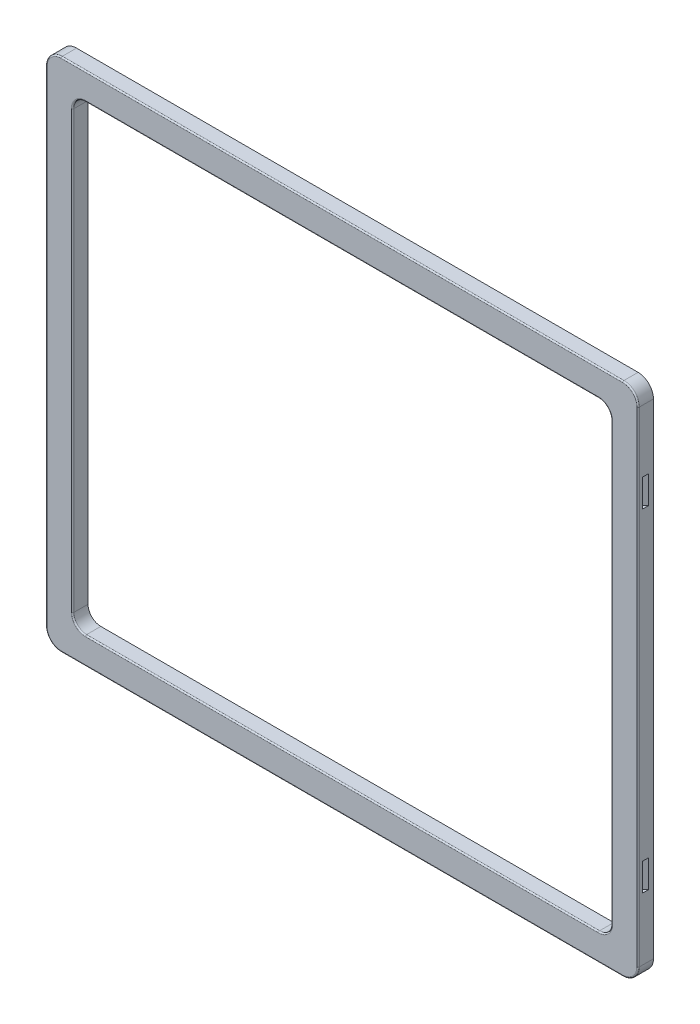
from build123d import *

# Parameters (mm, degrees)
SKETCH1_W                                = 231.5
SKETCH1_H                                = 201.5
SKETCH1_W_2                              = 210.5
SKETCH1_H_2                              = 180.5
MAIN_BODY_DEPTH                          = 6
FILLET1_R                                = 5
FILLET2_R                                = 6
SKETCH3_W                                = 227.5
SKETCH3_H                                = 197.5
SKETCH3_W_2                              = 214
SKETCH3_H_2                              = 184
MAIN_CAVITY_DEPTH                        = 5
FILLET6_R                                = 6
FILLET4_R                                = 5
CAVITY1_START                            = 83.43860018
CAVITY1_OUTLINE_W                        = 1.804040507
CAVITY1_OUTLINE_H                        = 10
CAVITY1_DEPTH                            = 1.060660172
CAVITY1_START_2                          = -80.256619665
CAVITY1_2_OUTLINE_W                      = 1.56139982
CAVITY1_2_OUTLINE_H                      = 10
CAVITY1_2_DEPTH                          = 1.060660172
SNAP_START                               = -0.4
SNAP_FIT_DEPTH                           = 10.8
MIRROR1_START                            = -0.4
MIRROR1_AT_THE_SECOND_PLANE_COPY_1_DEPTH = 10.8
FILLET7_R                                = 0.5


# Read off the part's stored shape, not the designer's step: Cavity1
with BuildPart() as part:
    # Sketch1 → Main Body (new body)
    with BuildSketch(Plane.XY):
        Rectangle(SKETCH1_W, SKETCH1_H)
        Rectangle(SKETCH1_W_2, SKETCH1_H_2, mode=Mode.SUBTRACT)
    extrude(amount=MAIN_BODY_DEPTH)

    # Fillet1
    fillet1_edges = [part.edges().sort_by_distance(p)[0] for p in [
        (105.25, -90.25, 3),
        (105.25, 90.25, 3),
        (-105.25, 90.25, 3),
        (-105.25, -90.25, 3),
    ]]
    fillet(fillet1_edges, radius=FILLET1_R)

    # Fillet2
    fillet2_edges = [part.edges().sort_by_distance(p)[0] for p in [
        (115.75, -100.75, 3),
        (-115.75, -100.75, 3),
        (-115.75, 100.75, 3),
        (115.75, 100.75, 3),
    ]]
    fillet(fillet2_edges, radius=FILLET2_R)

    # Sketch3 → Main Cavity (cut)
    with BuildSketch(Plane(origin=(0, 0, 0), x_dir=(-1, 0, 0), z_dir=(0, 0, -1))):
        Rectangle(SKETCH3_W, SKETCH3_H)
        Rectangle(SKETCH3_W_2, SKETCH3_H_2, mode=Mode.SUBTRACT)
    extrude(amount=-MAIN_CAVITY_DEPTH, mode=Mode.SUBTRACT)

    # Fillet6
    fillet6_edges = [part.edges().sort_by_distance(p)[0] for p in [
        (-113.75, 98.75, 2.5),
        (-113.75, -98.75, 2.5),
        (113.75, -98.75, 2.5),
        (113.75, 98.75, 2.5),
    ]]
    fillet(fillet6_edges, radius=FILLET6_R)

    # Fillet4
    fillet4_edges = [part.edges().sort_by_distance(p)[0] for p in [
        (-107, -92, 2.5),
        (107, -92, 2.5),
        (107, 92, 2.5),
        (-107, 92, 2.5),
    ]]
    fillet(fillet4_edges, radius=FILLET4_R)

    # Cavity1 outline → Cavity1 (cut)
    with BuildSketch(Plane(origin=(0, 0, 0), x_dir=(0.7071067811865474, 0, -0.7071067811865477), z_dir=(0.7071067811865476, 0, 0.7071067811865476)).offset(CAVITY1_START)):
        with Locations((80.097979747, 65)):
            Rectangle(CAVITY1_OUTLINE_W, CAVITY1_OUTLINE_H)
        with Locations((80.097979747, -65)):
            Rectangle(CAVITY1_OUTLINE_W, CAVITY1_OUTLINE_H)
    extrude(amount=CAVITY1_DEPTH, mode=Mode.SUBTRACT)

    # Cavity1 2 outline → Cavity1 2 (cut)
    with BuildSketch(Plane(origin=(0, 0, 0), x_dir=(0.7071067811865474, 0, -0.7071067811865477), z_dir=(0.7071067811865476, 0, 0.7071067811865476)).offset(CAVITY1_START_2)):
        with Locations((-84.21930009, 65)):
            Rectangle(CAVITY1_2_OUTLINE_W, CAVITY1_2_OUTLINE_H)
        with Locations((-84.21930009, -65)):
            Rectangle(CAVITY1_2_OUTLINE_W, CAVITY1_2_OUTLINE_H)
    extrude(amount=CAVITY1_2_DEPTH, mode=Mode.SUBTRACT)

    # Sketch4 → Snap Fit (cut)
    with BuildSketch(Plane.XZ.offset(-70).offset(SNAP_START)):
        Polygon((-115.75, 4.315685425), (-114.575735931, 3.141421356), (-115.75, 1.967157288), align=None)
    snap_fit = extrude(amount=SNAP_FIT_DEPTH, mode=Mode.SUBTRACT)

    # Mirror1: Snap Fit across plane
    add(snap_fit.mirror(Plane.ZX), mode=Mode.SUBTRACT)

    # Mirror1 at the second plane: Snap Fit across plane
    add(snap_fit.mirror(Plane(origin=(0, 0, 0), x_dir=(0, 0, 1), z_dir=(1, 0, 0))), mode=Mode.SUBTRACT)

    # Mirror1 at the second plane copy 1 sketc → Mirror1 at the second plane copy 1 (cut)
    with BuildSketch(Plane(origin=(0, -70, 0), x_dir=(-1, 0, 0), z_dir=(0, 1, 0)).offset(MIRROR1_START)):
        Polygon((-115.75, 4.315685425), (-114.575735931, 3.141421356), (-115.75, 1.967157288), align=None)
    extrude(amount=MIRROR1_AT_THE_SECOND_PLANE_COPY_1_DEPTH, mode=Mode.SUBTRACT)

    # Fillet7
    fillet7_edges = [part.edges().sort_by_distance(p)[0] for p in [
        (-113.75, 0, 5),
        (0, -98.75, 5),
        (0, 98.75, 5),
        (113.75, 0, 5),
        (-111.992640687, 96.992640687, 5),
        (111.992640687, 96.992640687, 5),
        (111.992640687, -96.992640687, 5),
        (-111.992640687, -96.992640687, 5),
        (107, 0, 5),
        (0, -92, 5),
        (0, 92, 5),
        (-107, 0, 5),
        (105.535533906, -90.535533906, 5),
        (105.535533906, 90.535533906, 5),
        (-105.535533906, 90.535533906, 5),
        (-105.535533906, -90.535533906, 5),
        (105.25, 0, 6),
        (0, 90.25, 6),
        (0, -90.25, 6),
        (-105.25, 0, 6),
        (103.785533906, 88.785533906, 6),
        (103.785533906, -88.785533906, 6),
        (-103.785533906, -88.785533906, 6),
        (-103.785533906, 88.785533906, 6),
        (0, 100.75, 6),
        (115.75, 0, 6),
        (-115.75, 0, 6),
        (0, -100.75, 6),
        (-113.992640687, 98.992640687, 6),
        (-113.992640687, -98.992640687, 6),
        (113.992640687, -98.992640687, 6),
        (113.992640687, 98.992640687, 6),
    ]]
    fillet(fillet7_edges, radius=FILLET7_R)


solid = part.part
